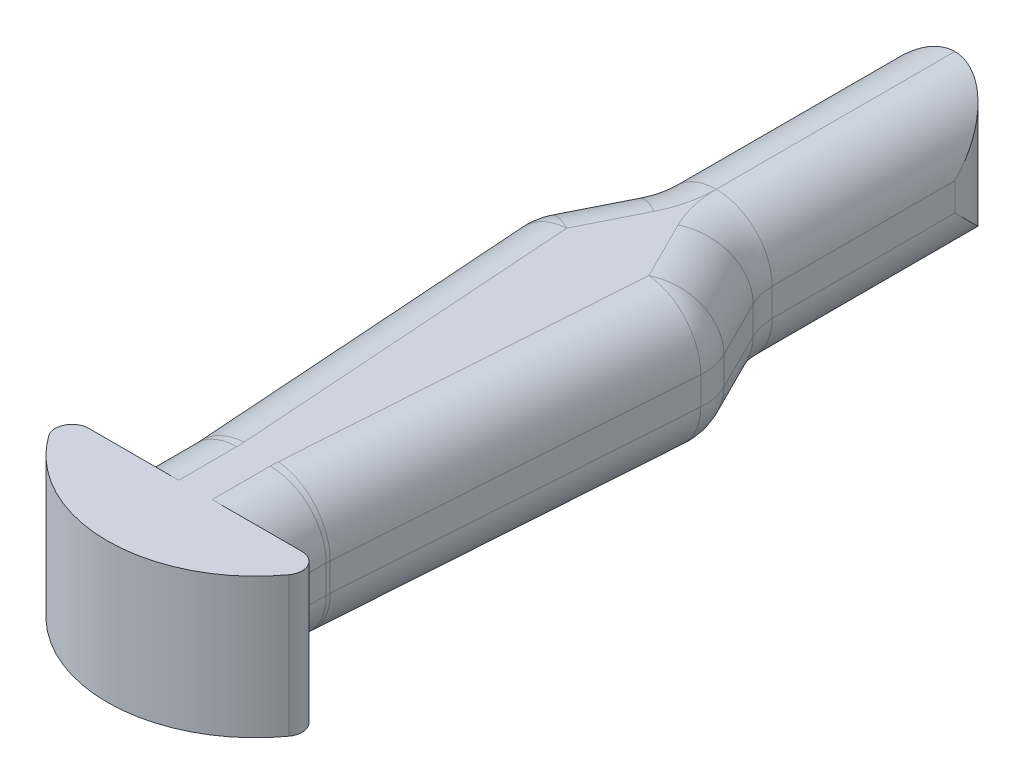
from build123d import *

# Parameters (mm, degrees)
SKETCH_1_W      = 26
SKETCH_1_H      = 0.722748137
EXTRUDE_1_DEPTH = 25
FILLET_1_R      = 3
FILLET_2_R      = 10


with BuildPart() as part:
    # 草图1 → 凸台-拉伸1 (new body)
    with BuildSketch(Plane(origin=(0, 0, 0), x_dir=(1, 0, 0), z_dir=(0, 1, 0))):
        with BuildLine():
            Line((-13, -85.256490319), (-13, -73.222748137))
            Line((-13, -73.222748137), (-24.211080276, -73.222748137))
            ThreePointArc((-24.211080276, -73.222748137), (0, -88.97930769), (24.211080276, -73.222748137))
            Line((24.211080276, -73.222748137), (13, -73.222748137))
            Line((13, -73.222748137), (13, -85.256490319))
            Line((13, -85.256490319), (-13, -85.256490319))
        make_face()
        with BuildLine():
            ThreePointArc((13, -73.222748137), (0, -79.351626853), (-13, -73.222748137))
            Line((-13, -73.222748137), (-13, -85.256490319))
            Line((-13, -85.256490319), (13, -85.256490319))
            Line((13, -85.256490319), (13, -73.222748137))
        make_face()
        with BuildLine():
            Line((13, -73.222748137), (-13, -73.222748137))
            ThreePointArc((-13, -73.222748137), (0, -79.351626853), (13, -73.222748137))
        make_face()
        with Locations((0, -72.861374068)):
            Rectangle(SKETCH_1_W, SKETCH_1_H)
        Polygon((13, -62.5), (0, -62.5), (-13, -62.5), (-13, -72.5), (13, -72.5), align=None)
        with BuildLine():
            Line((0, -62.5), (0, -45.648373147))
            ThreePointArc((0, -45.648373147), (-7.186152558, -47.257410357), (-13, -51.777251863))
            Line((-13, -51.777251863), (-13, -62.5))
            Line((-13, -62.5), (0, -62.5))
        make_face()
        with BuildLine():
            ThreePointArc((13, -51.777251863), (7.186152558, -47.257410357), (0, -45.648373147))
            Line((0, -45.648373147), (0, -62.5))
            Line((0, -62.5), (13, -62.5))
            Line((13, -62.5), (13, -51.777251863))
        make_face()
        with BuildLine():
            ThreePointArc((13, -39.431542406), (6.72000555, -36.887595561), (0, -36.02069231))
            Line((0, -36.02069231), (0, -45.648373147))
            ThreePointArc((0, -45.648373147), (7.186152558, -47.257410357), (13, -51.777251863))
            Line((13, -51.777251863), (13, -39.431542406))
        make_face()
        with BuildLine():
            Line((0, -45.648373147), (0, -36.02069231))
            ThreePointArc((0, -36.02069231), (-6.72000555, -36.887595561), (-13, -39.431542406))
            Line((-13, -39.431542406), (-13, -51.777251863))
            ThreePointArc((-13, -51.777251863), (-7.186152558, -47.257410357), (0, -45.648373147))
        make_face()
        with BuildLine():
            Line((0, -36.02069231), (0, 2.5))
            Line((0, 2.5), (-13, 2.5))
            Line((-13, 2.5), (-13, -39.431542406))
            ThreePointArc((-13, -39.431542406), (-6.72000555, -36.887595561), (0, -36.02069231))
        make_face()
        with BuildLine():
            Line((13, 2.5), (0, 2.5))
            Line((0, 2.5), (0, -36.02069231))
            ThreePointArc((0, -36.02069231), (6.72000555, -36.887595561), (13, -39.431542406))
            Line((13, -39.431542406), (13, 2.5))
        make_face()
        Polygon((0, 2.5), (0, 62.5), (-10, 62.5), (-10, 17.5), (-17.5, 2.5), (-13, 2.5), align=None)
        Polygon((10, 62.5), (0, 62.5), (0, 2.5), (13, 2.5), (17.5, 2.5), (10, 17.5), align=None)
        with BuildLine():
            Line((17.5, 2.5), (13, 2.5))
            Line((13, 2.5), (13, -39.431542406))
            ThreePointArc((13, -39.431542406), (13.774122837, -39.885242079), (14.532429345, -40.364909463))
            Line((14.532429345, -40.364909463), (17.5, 2.5))
        make_face()
        with BuildLine():
            Line((-13, -39.431542406), (-13, 2.5))
            Line((-13, 2.5), (-17.5, 2.5))
            Line((-17.5, 2.5), (-14.532429345, -40.364909463))
            ThreePointArc((-14.532429345, -40.364909463), (-13.774122837, -39.885242079), (-13, -39.431542406))
        make_face()
        with BuildLine():
            ThreePointArc((14.532429345, -40.364909463), (13.774122837, -39.885242079), (13, -39.431542406))
            Line((13, -39.431542406), (13, -51.777251863))
            ThreePointArc((13, -51.777251863), (13.347894441, -52.213550583), (13.681152635, -52.661128612))
            Line((13.681152635, -52.661128612), (14.532429345, -40.364909463))
        make_face()
        with BuildLine():
            Line((-13, -51.777251863), (-13, -39.431542406))
            ThreePointArc((-13, -39.431542406), (-13.774122837, -39.885242079), (-14.532429345, -40.364909463))
            Line((-14.532429345, -40.364909463), (-13.681152635, -52.661128612))
            ThreePointArc((-13.681152635, -52.661128612), (-13.347894441, -52.213550583), (-13, -51.777251863))
        make_face()
        with BuildLine():
            ThreePointArc((13.681152635, -52.661128612), (13.347894441, -52.213550583), (13, -51.777251863))
            Line((13, -51.777251863), (13, -62.5))
            Line((13, -62.5), (13.681152635, -52.661128612))
        make_face()
        with BuildLine():
            Line((-13, -62.5), (-13, -51.777251863))
            ThreePointArc((-13, -51.777251863), (-13.347894441, -52.213550583), (-13.681152635, -52.661128612))
            Line((-13.681152635, -52.661128612), (-13, -62.5))
        make_face()
    extrude(amount=EXTRUDE_1_DEPTH)

    # 圆角1
    fillet_1_edges = [part.edges().sort_by_distance(p)[0] for p in [
        (24.211080276, 12.5, 73.222748137),
        (-24.211080276, 12.5, 73.222748137),
    ]]
    fillet(fillet_1_edges, radius=FILLET_1_R)

    # 圆角2
    # the kernel refuses this fillet: 10 mm, written as the material it adds along each edge
    with BuildSketch(Plane(origin=(-10, 0, -17.5), x_dir=(-0.44721359549995854, 0, 0.8944271909999156), z_dir=(0, 1, 0)), Plane(origin=(10, 0, -17.5), x_dir=(0, 0, -1), z_dir=(0, 1, 0))) as fillet_2_piece_1:
        with BuildLine():
            CenterArc((FILLET_2_R * 0.2360679775, -FILLET_2_R), FILLET_2_R, 90, 26.565051177)
            Line((-FILLET_2_R * 0.211145618, -FILLET_2_R * 0.105572809), (0, 0))
            Line((0, 0), (FILLET_2_R * 0.2360679775, 0))
        make_face()
    extrude(amount=25)
    with BuildSketch(Plane(origin=(-13, 0, 62.5), x_dir=(0, 0, 1), z_dir=(0, 1, 0))) as fillet_2_piece_2:
        with BuildLine():
            CenterArc((FILLET_2_R * 0.0345740067021, -FILLET_2_R), FILLET_2_R, 90, 3.96031183)
            Line((-FILLET_2_R * 0.0344914484856, -FILLET_2_R * 0.00238786951054), (0, 0))
            Line((0, 0), (FILLET_2_R * 0.0345740067021, 0))
        make_face()
    extrude(amount=25)
    with BuildSketch(Plane(origin=(13, 0, 62.5), x_dir=(0, 0, 1), z_dir=(0, 1, 0))) as fillet_2_piece_3:
        with BuildLine():
            CenterArc((FILLET_2_R * 0.0345740067021, FILLET_2_R), FILLET_2_R, 266.03968817, 3.96031183)
            Line((-FILLET_2_R * 0.0344914484856, FILLET_2_R * 0.00238786951054), (0, 0))
            Line((0, 0), (FILLET_2_R * 0.0345740067021, 0))
        make_face()
    extrude(amount=25)
    # the kernel refuses this fillet: 10 mm, written as the material it takes off along each edge
    with BuildSketch(Plane(origin=(-10, -25, -62.5), x_dir=(0, 0, 1), z_dir=(0, 1, 0)), Plane(origin=(10, -25, -62.5), x_dir=(-1, 0, 0), z_dir=(0, 1, 0))) as fillet_2_2_piece_1:
        with BuildLine():
            CenterArc((FILLET_2_R, FILLET_2_R), FILLET_2_R, 180, 90)
            Line((0, FILLET_2_R), (0, 0))
            Line((0, 0), (FILLET_2_R, 0))
        make_face()
    extrude(amount=75, mode=Mode.SUBTRACT)
    with BuildSketch(Plane(origin=(-17.5, -6.821727287, -2.5), x_dir=(0.06906545518773138, 0, 0.9976121304894561), z_dir=(0, 1, 0))) as fillet_2_2_piece_2:
        with BuildLine():
            CenterArc((FILLET_2_R * 0.272869091474, FILLET_2_R), FILLET_2_R, 239.474636992, 30.525363008)
            Line((-FILLET_2_R * 0.235050637395, FILLET_2_R * 0.138595594958), (0, 0))
            Line((0, 0), (FILLET_2_R * 0.272869091474, 0))
        make_face()
    extrude(amount=38.643454574, mode=Mode.SUBTRACT)
    with BuildSketch(Plane(origin=(17.5, -6.821727287, -2.5), x_dir=(-0.06906545518773137, 0, 0.9976121304894561), z_dir=(0, 1, 0))) as fillet_2_2_piece_3:
        with BuildLine():
            CenterArc((FILLET_2_R * 0.272869091474, -FILLET_2_R), FILLET_2_R, 90, 30.525363008)
            Line((-FILLET_2_R * 0.235050637395, -FILLET_2_R * 0.138595594958), (0, 0))
            Line((0, 0), (FILLET_2_R * 0.272869091474, 0))
        make_face()
    extrude(amount=38.643454574, mode=Mode.SUBTRACT)
    # the kernel refuses this fillet: 10 mm, written as the material it takes off along each edge
    with BuildSketch(Plane(origin=(-13, 0, 62.845740067), x_dir=(1, 0, 0), z_dir=(0, 0, 1)), Plane(origin=(-13, 25, 62.845740067), x_dir=(0, -1, 0), z_dir=(0, 0, 1)), Plane(origin=(13, 25, 73.222748137), x_dir=(0, -1, 0), z_dir=(0, 0, -1))) as fillet_2_3_piece_1:
        with BuildLine():
            CenterArc((FILLET_2_R, FILLET_2_R), FILLET_2_R, 180, 90)
            Line((0, FILLET_2_R), (0, 0))
            Line((0, 0), (FILLET_2_R, 0))
        make_face()
    extrude(amount=10.37700807, mode=Mode.SUBTRACT)
    with BuildSketch(Plane(origin=(13, 0, 62.845740067), x_dir=(-1, 0, 0), z_dir=(0, 0, 1))) as fillet_2_3_piece_2:
        with BuildLine():
            CenterArc((FILLET_2_R, -FILLET_2_R), FILLET_2_R, 90, 90)
            Line((0, -FILLET_2_R), (0, 0))
            Line((0, 0), (FILLET_2_R, 0))
        make_face()
    extrude(amount=10.37700807, mode=Mode.SUBTRACT)
    with BuildSketch(Plane(origin=(16.279692325, 0, -4.94061535), x_dir=(-0.8944271909999149, 0, 0.44721359549996015), z_dir=(-0.44721359549996015, 0, -0.8944271909999147)), Plane(origin=(16.279692325, 25, -4.94061535), x_dir=(0, -1, 0), z_dir=(-0.44721359549996015, 0, -0.8944271909999147)), Plane(origin=(-11.05572809, 0, -15.38854382), x_dir=(0.8944271909999155, 0, 0.44721359549995876), z_dir=(-0.4472135954999587, 0, 0.8944271909999155)), Plane(origin=(-11.05572809, 25, -15.38854382), x_dir=(0, -1, 0), z_dir=(-0.4472135954999587, 0, 0.8944271909999155))) as fillet_2_3_piece_3:
        with BuildLine():
            CenterArc((FILLET_2_R, FILLET_2_R), FILLET_2_R, 180, 90)
            Line((0, FILLET_2_R), (0, 0))
            Line((0, 0), (FILLET_2_R, 0))
        make_face()
    extrude(amount=11.681139142, mode=Mode.SUBTRACT)
    with BuildSketch(Plane(origin=(-10, 0, -77.5), x_dir=(1, 0, 0), z_dir=(0, 0, 1)), Plane(origin=(-10, 25, -77.5), x_dir=(0, -1, 0), z_dir=(0, 0, 1)), Plane(origin=(10, 0, -19.860679775), x_dir=(-1, 0, 0), z_dir=(0, 0, -1)), Plane(origin=(10, 25, -19.860679775), x_dir=(0, -1, 0), z_dir=(0, 0, -1))) as fillet_2_3_piece_4:
        with BuildLine():
            CenterArc((FILLET_2_R, FILLET_2_R), FILLET_2_R, 180, 90)
            Line((0, FILLET_2_R), (0, 0))
            Line((0, 0), (FILLET_2_R, 0))
        make_face()
    extrude(amount=57.639320225, mode=Mode.SUBTRACT)
    with BuildSketch(Plane(origin=(-13.023878695, 0, 62.155085515), x_dir=(0.9976121304894561, 0, -0.06906545518773156), z_dir=(-0.06906545518773156, 0, -0.9976121304894561)), Plane(origin=(17.31154172, 0, 0.222175157), x_dir=(-0.9976121304894561, 0, -0.06906545518773156), z_dir=(-0.06906545518773156, 0, 0.9976121304894561))) as fillet_2_3_piece_5:
        with BuildLine():
            CenterArc((FILLET_2_R, -FILLET_2_R), FILLET_2_R, 90, 90)
            Line((0, -FILLET_2_R), (0, 0))
            Line((0, 0), (FILLET_2_R, 0))
        make_face()
    extrude(amount=62.081152048, mode=Mode.SUBTRACT)
    with BuildSketch(Plane(origin=(-17.31154172, 25, 0.222175157), x_dir=(0, -1, 0), z_dir=(0.06906545518773156, 0, 0.9976121304894561)), Plane(origin=(13.023878695, 25, 62.155085515), x_dir=(0, -1, 0), z_dir=(0.06906545518773156, 0, -0.9976121304894561))) as fillet_2_3_piece_6:
        with BuildLine():
            CenterArc((FILLET_2_R, FILLET_2_R), FILLET_2_R, 180, 90)
            Line((0, FILLET_2_R), (0, 0))
            Line((0, 0), (FILLET_2_R, 0))
        make_face()
    extrude(amount=62.081152048, mode=Mode.SUBTRACT)
    with BuildSketch(Plane(origin=(20, 25, -19.860679775), x_dir=(-1, 0, 0), z_dir=(0, 0, -1))) as fillet_2_3_piece_7:
        with BuildLine():
            CenterArc((10 + FILLET_2_R, -FILLET_2_R), FILLET_2_R, 90, 90)
            Line((10 + FILLET_2_R, 0), (10, 0))
            Line((10, 0), (10, -FILLET_2_R))
        make_face()
    revolve(axis=Axis((20, 25, -19.860679775), (0, 1, 0)), revolution_arc=26.565051177, mode=Mode.SUBTRACT)
    with BuildSketch(Plane(origin=(20, 0, -19.860679775), x_dir=(-1, 0, 0), z_dir=(0, 0, -1))) as fillet_2_3_piece_8:
        with BuildLine():
            CenterArc((10 + FILLET_2_R, FILLET_2_R), FILLET_2_R, 180, 90)
            Line((10, FILLET_2_R), (10, 0))
            Line((10, 0), (10 + FILLET_2_R, 0))
        make_face()
    revolve(axis=Axis((20, 0, -19.860679775), (0, 1, 0)), revolution_arc=26.565051177, mode=Mode.SUBTRACT)
    with BuildSketch(Plane(origin=(23, 25, 62.845740067), x_dir=(-1, 0, 0), z_dir=(0, 0, 1))) as fillet_2_3_piece_9:
        with BuildLine():
            CenterArc((10 + FILLET_2_R, FILLET_2_R), FILLET_2_R, 180, 90)
            Line((10 + FILLET_2_R, 0), (10, 0))
            Line((10, 0), (10, FILLET_2_R))
        make_face()
    revolve(axis=Axis((23, 25, 62.845740067), (0, -1, 0)), revolution_arc=3.96031183, mode=Mode.SUBTRACT)
    with BuildSketch(Plane(origin=(7.335420415, 25, -0.468479395), x_dir=(0.8944271909999149, 0, -0.4472135954999599), z_dir=(-0.4472135954999599, 0, -0.8944271909999149))) as fillet_2_3_piece_10:
        with BuildLine():
            CenterArc((10 - FILLET_2_R, FILLET_2_R), FILLET_2_R, 270, 90)
            Line((10 - FILLET_2_R, 0), (10, 0))
            Line((10, 0), (10, FILLET_2_R))
        make_face()
    revolve(axis=Axis((7.335420415, 25, -0.468479395), (0, -1, 0)), revolution_arc=30.525363008, mode=Mode.SUBTRACT)
    with BuildSketch(Plane(origin=(7.335420415, 0, -0.468479395), x_dir=(0.8944271909999149, 0, -0.4472135954999599), z_dir=(-0.4472135954999599, 0, -0.8944271909999149))) as fillet_2_3_piece_11:
        with BuildLine():
            CenterArc((10 - FILLET_2_R, -FILLET_2_R), FILLET_2_R, 0, 90)
            Line((10, -FILLET_2_R), (10, 0))
            Line((10, 0), (10 - FILLET_2_R, 0))
        make_face()
    revolve(axis=Axis((7.335420415, 0, -0.468479395), (0, -1, 0)), revolution_arc=30.525363008, mode=Mode.SUBTRACT)
    with BuildSketch(Plane(origin=(23, 0, 62.845740067), x_dir=(-1, 0, 0), z_dir=(0, 0, 1))) as fillet_2_3_piece_12:
        with BuildLine():
            CenterArc((10 + FILLET_2_R, -FILLET_2_R), FILLET_2_R, 90, 90)
            Line((10, -FILLET_2_R), (10, 0))
            Line((10, 0), (10 + FILLET_2_R, 0))
        make_face()
    revolve(axis=Axis((23, 0, 62.845740067), (0, -1, 0)), revolution_arc=3.96031183, mode=Mode.SUBTRACT)
    with BuildSketch(Plane(origin=(-7.335420415, 25, -0.468479395), x_dir=(-0.9976121304894561, 0, 0.06906545518773152), z_dir=(0.06906545518773152, 0, 0.9976121304894561))) as fillet_2_3_piece_13:
        with BuildLine():
            CenterArc((10 - FILLET_2_R, FILLET_2_R), FILLET_2_R, 270, 90)
            Line((10 - FILLET_2_R, 0), (10, 0))
            Line((10, 0), (10, FILLET_2_R))
        make_face()
    revolve(axis=Axis((-7.335420415, 25, -0.468479395), (0, -1, 0)), revolution_arc=30.525363008, mode=Mode.SUBTRACT)
    with BuildSketch(Plane(origin=(-23, 25, 62.845740067), x_dir=(1, 0, 0), z_dir=(0, 0, 1))) as fillet_2_3_piece_14:
        with BuildLine():
            CenterArc((10 + FILLET_2_R, -FILLET_2_R), FILLET_2_R, 90, 90)
            Line((10 + FILLET_2_R, 0), (10, 0))
            Line((10, 0), (10, -FILLET_2_R))
        make_face()
    revolve(axis=Axis((-23, 25, 62.845740067), (0, 1, 0)), revolution_arc=3.96031183, mode=Mode.SUBTRACT)
    with BuildSketch(Plane(origin=(-23, 0, 62.845740067), x_dir=(1, 0, 0), z_dir=(0, 0, 1))) as fillet_2_3_piece_15:
        with BuildLine():
            CenterArc((10 + FILLET_2_R, FILLET_2_R), FILLET_2_R, 180, 90)
            Line((10, FILLET_2_R), (10, 0))
            Line((10, 0), (10 + FILLET_2_R, 0))
        make_face()
    revolve(axis=Axis((-23, 0, 62.845740067), (0, 1, 0)), revolution_arc=3.96031183, mode=Mode.SUBTRACT)
    with BuildSketch(Plane(origin=(-7.335420415, 0, -0.468479395), x_dir=(-0.9976121304894561, 0, 0.06906545518773152), z_dir=(0.06906545518773152, 0, 0.9976121304894561))) as fillet_2_3_piece_16:
        with BuildLine():
            CenterArc((10 - FILLET_2_R, -FILLET_2_R), FILLET_2_R, 0, 90)
            Line((10, -FILLET_2_R), (10, 0))
            Line((10, 0), (10 - FILLET_2_R, 0))
        make_face()
    revolve(axis=Axis((-7.335420415, 0, -0.468479395), (0, -1, 0)), revolution_arc=30.525363008, mode=Mode.SUBTRACT)
    with BuildSketch(Plane(origin=(-20, 25, -19.860679775), x_dir=(0.8944271909999155, 0, 0.44721359549995865), z_dir=(-0.44721359549995865, 0, 0.8944271909999155))) as fillet_2_3_piece_17:
        with BuildLine():
            CenterArc((10 + FILLET_2_R, -FILLET_2_R), FILLET_2_R, 90, 90)
            Line((10 + FILLET_2_R, 0), (10, 0))
            Line((10, 0), (10, -FILLET_2_R))
        make_face()
    revolve(axis=Axis((-20, 25, -19.860679775), (0, 1, 0)), revolution_arc=26.565051177, mode=Mode.SUBTRACT)
    with BuildSketch(Plane(origin=(-20, 0, -19.860679775), x_dir=(0.8944271909999155, 0, 0.44721359549995865), z_dir=(-0.44721359549995865, 0, 0.8944271909999155))) as fillet_2_3_piece_18:
        with BuildLine():
            CenterArc((10 + FILLET_2_R, FILLET_2_R), FILLET_2_R, 180, 90)
            Line((10, FILLET_2_R), (10, 0))
            Line((10, 0), (10 + FILLET_2_R, 0))
        make_face()
    revolve(axis=Axis((-20, 0, -19.860679775), (0, 1, 0)), revolution_arc=26.565051177, mode=Mode.SUBTRACT)


solid = part.part
